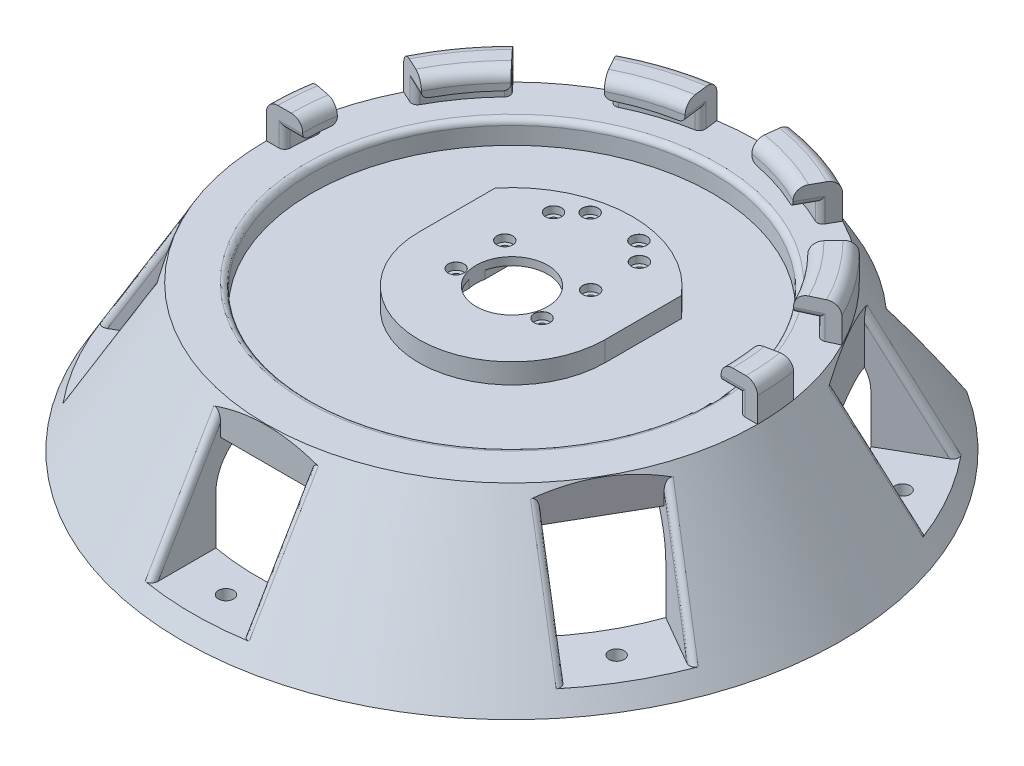
from build123d import *

# Parameters (mm, degrees)
SKETCH2_R                       = 12.5
CUT_EXTRUDE1_DEPTH              = 171.457229262
SKETCH3_R                       = 69.999999954
CUT_EXTRUDE2_DEPTH              = 8.000000002
CUT_EXTRUDE5_DEPTH              = 39
SKETCH8_W                       = 31.75
SKETCH8_H                       = 38.1
CUT_EXTRUDE6_DEPTH              = 44.45
CIRPATTERN2_COUNT               = 6
SKETCH9_R                       = 2.649982
CUT_EXTRUDE7_DEPTH              = 171.457229262
CIRPATTERN3_COUNT               = 6
REVOLVE2_ANGLE                  = 180
CUT_EXTRUDE9_DEPTH              = 12.7
SKETCH3_3_R                     = 12.5
CUT_EXTRUDE11_DEPTH             = 1
CBORE_FOR_M2_5_SHCS1_AT_2_COUNT = 2
CBORE_FOR_M2_5_SHCS1_AT_2_PITCH = 17
CBORE_FOR_M2_5_SHCS1_AT_3_COUNT = 2
CBORE_FOR_M2_5_SHCS1_AT_3_PITCH = 34
CBORE_FOR_M2_5_SHCS1_AT_4_COUNT = 2
CBORE_FOR_M2_5_SHCS1_AT_4_PITCH = 40.820828017
CBORE_FOR_M2_5_SHCS1_AT_5_COUNT = 2
CBORE_FOR_M2_5_SHCS1_AT_5_PITCH = 46.651259361
CBORE_FOR_M2_5_SHCS1_AT_6_COUNT = 2
CBORE_FOR_M2_5_SHCS1_AT_6_PITCH = 45.343136195
CBORE_FOR_M2_5_SHCS1_AT_7_COUNT = 2
CBORE_FOR_M2_5_SHCS1_AT_7_PITCH = 34.481879299
CBORE_FOR_M2_5_SHCS1_AT_8_COUNT = 2
CBORE_FOR_M2_5_SHCS1_AT_8_PITCH = 30
FILLET1_R                       = 4
FILLET2_R                       = 2
FILLET3_R                       = 2
FILLET4_R                       = 2
FILLET5_R                       = 2
FILLET6_R                       = 16
FILLET7_R                       = 16
FILLET8_R                       = 16
FILLET9_R                       = 1
CUT_EXTRUDE12_DEPTH             = 8.05
CUT_EXTRUDE15_START             = -5.3
SKETCH20_R                      = 1.45
CUT_EXTRUDE15_DEPTH             = 5.3


# Some blends are built 0.0001 mm under size
with BuildPart() as part:
    # Sketch1 → Revolve1 (revolve)
    with BuildSketch(Plane.XY, mode=Mode.PRIVATE) as revolve1_sk:
        Polygon((0, 0), (-85.725, 0), (-115.054393675, -50.8), (0, -50.8), align=None)
    revolve(revolve1_sk.sketch.rotate(Axis((0, 0, 0), (0, -1, 0)), 270), axis=Axis((0, 0, 0), (0, -1, 0)))

    # Sketch2 → Cut-Extrude1 (cut, through all)
    with BuildSketch(Plane(origin=(0, 0, 0), x_dir=(1, 0, 0), z_dir=(0, 1, 0))):
        with Locations(Location((0, 0, 0), (0, 0, 270))):
            Circle(SKETCH2_R)
    extrude(amount=-CUT_EXTRUDE1_DEPTH, mode=Mode.SUBTRACT)

    # Sketch3 → Cut-Extrude2 (cut)
    with BuildSketch(Plane(origin=(0, 0, 0), x_dir=(1, 0, 0), z_dir=(0, 1, 0))):
        with Locations(Location((0, 0, 0), (0, 0, 270))):
            Circle(SKETCH3_R)
        with BuildLine():
            ThreePointArc((32.5, 0), (0, -32.5), (-32.5, 0))
            Line((-32.5, 0), (-32.5, 26.603571189))
            ThreePointArc((-32.5, 26.603571189), (0, 42), (32.5, 26.603571189))
            Line((32.5, 26.603571189), (32.5, 0))
        make_face(mode=Mode.SUBTRACT)
    extrude(amount=-CUT_EXTRUDE2_DEPTH, mode=Mode.SUBTRACT)

    # Sketch7 → Cut-Extrude5 (cut)
    with BuildSketch(Plane.XZ.offset(50.8)):
        with BuildLine():
            Line((-60, -65.598856697), (-60, -161.1))
            Line((-60, -161.1), (60, -161.1))
            Line((60, -161.1), (60, -65.598856697))
            ThreePointArc((60, -65.598856697), (0, 88.9), (-60, -65.598856697))
        make_face()
    extrude(amount=-CUT_EXTRUDE5_DEPTH, mode=Mode.SUBTRACT)

    # Sketch8 → Cut-Extrude6 (cut)
    with BuildSketch(Plane(origin=(0, 0, 0), x_dir=(1, 0, 0), z_dir=(0, 1, 0))):
        with Locations((0, -104.875)):
            Rectangle(SKETCH8_W, SKETCH8_H)
    cut_extrude6 = extrude(amount=-CUT_EXTRUDE6_DEPTH, mode=Mode.SUBTRACT)

    # CirPattern2: Cut-Extrude6 ×6 about axis, 1 skipped
    cirpattern2_axis = Axis((0, 0, 0), (0, -1, 0))
    add([cut_extrude6.rotate(cirpattern2_axis, i * 360 / CIRPATTERN2_COUNT) for i in range(1, CIRPATTERN2_COUNT) if i not in (3,)], mode=Mode.SUBTRACT)

    # Sketch9 → Cut-Extrude7 (cut, through all)
    with BuildSketch(Plane(origin=(0, 0, 0), x_dir=(1, 0, 0), z_dir=(0, 1, 0))):
        with Locations(Location((0, -99.814393675, 0), (0, 0, 270))):
            Circle(SKETCH9_R)
    cut_extrude7 = extrude(amount=-CUT_EXTRUDE7_DEPTH, mode=Mode.SUBTRACT)

    # CirPattern3: Cut-Extrude7 ×6 about axis
    cirpattern3_axis = Axis((0, 0, 0), (0, 1, 0))
    for i in range(1, CIRPATTERN3_COUNT):
        add(cut_extrude7.rotate(cirpattern3_axis, i * 360 / CIRPATTERN3_COUNT), mode=Mode.SUBTRACT)

    # Sketch12 → Revolve2 (revolve)
    with BuildSketch(Plane.XY):
        Polygon((85.725, 0), (85.725, 12.7), (73.025, 12.7), (73.025, 6.35), (79.375, 6.35), (79.375, 0), align=None)
    revolve(axis=Axis((0, 0, 0), (0, 1, 0)), revolution_arc=REVOLVE2_ANGLE)

    # Sketch18 → Cut-Extrude9 (cut)
    with BuildSketch(Plane(origin=(0, 12.7, 0), x_dir=(1, 0, 0), z_dir=(0, 1, 0))):
        Polygon((46.643270314, 89.718478222), (70.913780145, 72.084920653), (36.670415564, 35.160782448), (22.108109665, 45.740916989), align=None)
        Polygon((-15, 100), (-9, 50), (9, 50), (15, 100), align=None)
        Polygon((90.470396714, 45.167547182), (99.740906545, 16.635851693), (50.333978764, 6.891341072), (44.771672865, 24.010358365), align=None)
        Polygon((99.740906545, -16.635851693), (90.470396714, -45.167547182), (44.771672865, -24.010358365), (50.333978764, -6.891341072), align=None)
        Polygon((70.913780145, -72.084920653), (46.643270314, -89.718478222), (22.108109665, -45.740916989), (36.670415564, -35.160782448), align=None)
        Polygon((15, -100), (-15, -100), (-9, -50), (9, -50), align=None)
        Polygon((-46.643270314, -89.718478222), (-70.913780145, -72.084920653), (-36.670415564, -35.160782448), (-22.108109665, -45.740916989), align=None)
        Polygon((-90.470396714, -45.167547182), (-99.740906545, -16.635851693), (-50.333978764, -6.891341072), (-44.771672865, -24.010358365), align=None)
        Polygon((-99.740906545, 16.635851693), (-90.470396714, 45.167547182), (-44.771672865, 24.010358365), (-50.333978764, 6.891341072), align=None)
        Polygon((-70.913780145, 72.084920653), (-46.643270314, 89.718478222), (-22.108109665, 45.740916989), (-36.670415564, 35.160782448), align=None)
    extrude(amount=-CUT_EXTRUDE9_DEPTH, mode=Mode.SUBTRACT)

    # Sketch3<3> → Cut-Extrude11 (cut)
    # profile 1 of 5: a face of its own
    with BuildSketch(Plane(origin=(0, 0, 0), x_dir=(1, 0, 0), z_dir=(0, 1, 0))):
        with BuildLine():
            ThreePointArc((-18.668154703, 26.603571189), (-28.835438507, 14.992247533), (-32.5, 0))
            ThreePointArc((-32.5, 0), (0, -32.5), (32.5, 0))
            ThreePointArc((32.5, 0), (28.835438507, 14.992247533), (18.668154703, 26.603571189))
            Line((18.668154703, 26.603571189), (-18.668154703, 26.603571189))
        make_face()
        with Locations(Location((0, 0, 0), (0, 0, 270))):
            Circle(SKETCH3_3_R, mode=Mode.SUBTRACT)
    # profile 2 of 5: a face of its own
    with BuildSketch(Plane(origin=(0, 0, 0), x_dir=(1, 0, 0), z_dir=(0, 1, 0))):
        with BuildLine():
            Line((-32.5, 26.603571189), (-32.5, 0))
            ThreePointArc((-32.5, 0), (-28.835438507, 14.992247533), (-18.668154703, 26.603571189))
            Line((-18.668154703, 26.603571189), (-32.5, 26.603571189))
        make_face()
    # profile 3 of 5: a face of its own
    with BuildSketch(Plane(origin=(0, 0, 0), x_dir=(1, 0, 0), z_dir=(0, 1, 0))):
        with BuildLine():
            ThreePointArc((18.668154703, 26.603571189), (0, 32.5), (-18.668154703, 26.603571189))
            Line((-18.668154703, 26.603571189), (18.668154703, 26.603571189))
        make_face()
    # profile 4 of 5: a face of its own
    with BuildSketch(Plane(origin=(0, 0, 0), x_dir=(1, 0, 0), z_dir=(0, 1, 0))):
        with BuildLine():
            ThreePointArc((32.5, 26.603571189), (0, 42), (-32.5, 26.603571189))
            Line((-32.5, 26.603571189), (-18.668154703, 26.603571189))
            ThreePointArc((-18.668154703, 26.603571189), (0, 32.5), (18.668154703, 26.603571189))
            Line((18.668154703, 26.603571189), (32.5, 26.603571189))
        make_face()
    # profile 5 of 5: a face of its own
    with BuildSketch(Plane(origin=(0, 0, 0), x_dir=(1, 0, 0), z_dir=(0, 1, 0))):
        with BuildLine():
            ThreePointArc((18.668154703, 26.603571189), (28.835438507, 14.992247533), (32.5, 0))
            Line((32.5, 0), (32.5, 26.603571189))
            Line((32.5, 26.603571189), (18.668154703, 26.603571189))
        make_face()
    extrude(amount=-CUT_EXTRUDE11_DEPTH, mode=Mode.SUBTRACT)

    # Sketch24 → CBORE for M2.5 SHCS1 (revolve, cut)
    with BuildSketch(Plane(origin=(-15, -1, 4.5), x_dir=(0, 0, 1), z_dir=(1, 0, 0))):
        Polygon((0, 0), (0, 49.8), (1.45, 49.8), (1.45, 2.5), (2.75, 2.5), (2.75, 0.025), (2.775, 0), align=None)
    cbore_for_m2_5_shcs1 = revolve(axis=Axis((-15, 5.35, 4.5), (0, -1, 0)), mode=Mode.SUBTRACT)

    # CBORE for M2.5 SHCS1 at 2: CBORE for M2.5 SHCS1 ×2
    with Locations(*[(0, 0, -i * CBORE_FOR_M2_5_SHCS1_AT_2_PITCH) for i in range(1, CBORE_FOR_M2_5_SHCS1_AT_2_COUNT)]):
        add(cbore_for_m2_5_shcs1, mode=Mode.SUBTRACT)

    # CBORE for M2.5 SHCS1 at 3: CBORE for M2.5 SHCS1 ×2
    with Locations(*[(0, 0, -i * CBORE_FOR_M2_5_SHCS1_AT_3_PITCH) for i in range(1, CBORE_FOR_M2_5_SHCS1_AT_3_COUNT)]):
        add(cbore_for_m2_5_shcs1, mode=Mode.SUBTRACT)

    # CBORE for M2.5 SHCS1 at 4: CBORE for M2.5 SHCS1 ×2
    with Locations(*[Vector(0.15923243882462063, 0, -0.9872411207126472) * (i * CBORE_FOR_M2_5_SHCS1_AT_4_PITCH) for i in range(1, CBORE_FOR_M2_5_SHCS1_AT_4_COUNT)]):
        add(cbore_for_m2_5_shcs1, mode=Mode.SUBTRACT)

    # CBORE for M2.5 SHCS1 at 5: CBORE for M2.5 SHCS1 ×2
    with Locations(*[Vector(0.5037377408822789, 0, -0.8638566364917376) * (i * CBORE_FOR_M2_5_SHCS1_AT_5_PITCH) for i in range(1, CBORE_FOR_M2_5_SHCS1_AT_5_COUNT)]):
        add(cbore_for_m2_5_shcs1, mode=Mode.SUBTRACT)

    # CBORE for M2.5 SHCS1 at 6: CBORE for M2.5 SHCS1 ×2
    with Locations(*[Vector(0.6616216370868465, 0, -0.7498378553650925) * (i * CBORE_FOR_M2_5_SHCS1_AT_6_PITCH) for i in range(1, CBORE_FOR_M2_5_SHCS1_AT_6_COUNT)]):
        add(cbore_for_m2_5_shcs1, mode=Mode.SUBTRACT)

    # CBORE for M2.5 SHCS1 at 7: CBORE for M2.5 SHCS1 ×2
    with Locations(*[Vector(0.8700221858486125, 0, -0.4930125719808802) * (i * CBORE_FOR_M2_5_SHCS1_AT_7_PITCH) for i in range(1, CBORE_FOR_M2_5_SHCS1_AT_7_COUNT)]):
        add(cbore_for_m2_5_shcs1, mode=Mode.SUBTRACT)

    # CBORE for M2.5 SHCS1 at 8: CBORE for M2.5 SHCS1 ×2
    with Locations(*[(i * CBORE_FOR_M2_5_SHCS1_AT_8_PITCH, 0, 0) for i in range(1, CBORE_FOR_M2_5_SHCS1_AT_8_COUNT)]):
        add(cbore_for_m2_5_shcs1, mode=Mode.SUBTRACT)

    # Fillet1
    fillet1_edges = [part.edges().sort_by_distance(p)[0] for p in [
        (-85.450905057, 12.7, -6.849704366),
        (-72.808821363, 12.7, -5.614815819),
        (-59.078466014, 12.7, -42.923018049),
        (-22.565966014, 12.7, -69.450902102),
        (22.565966014, 12.7, -69.450902102),
        (59.078466014, 12.7, -42.923018049),
        (72.808821363, 12.7, -5.614815819),
        (-69.352981843, 12.7, -50.387890753),
        (-26.490481843, 12.7, -81.529319859),
        (26.490481843, 12.7, -81.529319859),
        (69.352981843, 12.7, -50.387890753),
        (85.450905057, 12.7, -6.849704365),
    ]]
    fillet(fillet1_edges, radius=FILLET1_R)

    # Fillet2
    fillet2_edges = [part.edges().sort_by_distance(p)[0] for p in [
        (-76.2, 6.35, 0),
        (76.2, 6.35, 0),
        (67.844410645, 6.35, -34.692369341),
        (75.278944251, 6.35, -11.811227656),
        (34.49561812, 6.35, -67.9446604),
        (53.95947979, 6.35, -53.803337137),
        (-75.278944251, 6.35, -11.811227656),
        (-67.844410645, 6.35, -34.692369341),
        (-53.95947979, 6.35, -53.803337137),
        (-34.49561812, 6.35, -67.9446604),
        (12.029328065, 6.35, -75.24440054),
        (-12.029328065, 6.35, -75.24440054),
    ]]
    fillet(fillet2_edges, radius=FILLET2_R)

    # Fillet3
    fillet3_edges = [part.edges().sort_by_distance(p)[0] for p in [
        (-78.396323126, 4.175, -12.426067172),
        (-56.120098678, 4.175, -56.133102082),
        (-70.727816733, 4.175, -36.027303052),
        (-12.407903987, 4.175, -78.399199892),
        (56.120098678, 4.175, -56.133102082),
        (78.396323126, 4.175, -12.426067171),
        (-79.375, 4.175, 0),
        (-36.043688298, 4.175, -70.719468033),
        (12.407903987, 4.175, -78.399199892),
        (36.043688298, 4.175, -70.719468033),
        (70.727816733, 4.175, -36.027303052),
        (79.375, 4.175, 0),
    ]]
    fillet(fillet3_edges, radius=FILLET3_R)

    # Fillet4
    fillet4_edges = [part.edges().sort_by_distance(p)[0] for p in [
        (92.853698409, -23.56380487, 35.278236725),
        (76.978698409, -23.56380487, 62.774543295),
        (76.978698409, -23.56380487, -62.774543295),
        (92.853698409, -23.56380487, -35.278236725),
        (-92.853698409, -23.56380487, -35.278236725),
        (-76.978698409, -23.56380487, -62.774543295),
        (-76.978698409, -23.56380487, 62.774543295),
        (-92.853698409, -23.56380487, 35.278236725),
        (15.875, -23.56380487, 98.05278002),
        (-15.875, -23.56380487, 98.05278002),
    ]]
    fillet(fillet4_edges, radius=FILLET4_R)

    # Fillet5
    fillet5_edges = [part.edges().sort_by_distance(p)[0] for p in [
        (0, 0, -69.999999954),
    ]]
    fillet(fillet5_edges, radius=FILLET5_R)

    # Fillet6
    # the kernel refuses this fillet: 16 mm, written as the material it adds along each edge
    with BuildSketch(Plane(origin=(0, -11.8, 0), x_dir=(0.26715940650180947, 0, 0.9636523499258438), z_dir=(0.9636523499258438, 0, -0.26715940650180947))) as fillet6_piece_1_section:
        with BuildLine():
            CenterArc((88.9 - FILLET6_R, FILLET6_R), FILLET6_R, 270, 90)
            Line((88.9, FILLET6_R), (88.9, 0))
            Line((88.9, 0), (88.9 - FILLET6_R, 0))
        make_face()
    fillet6_piece_1 = revolve(axis=Axis((0, -11.8, 0), (0, -1, 0)), revolution_arc=90.990609321, mode=Mode.PRIVATE)
    fillet6_piece_1 = split(fillet6_piece_1, bisect_by=Plane(origin=(15.875, -14.981885519, 82.675852162), z_dir=(1, 0, 0)), keep=Keep.TOP, mode=Mode.PRIVATE)
    add(fillet6_piece_1)
    with BuildSketch(Plane(origin=(0, -11.8, 0), x_dir=(0.26715940650180947, 0, 0.9636523499258438), z_dir=(0.9636523499258438, 0, -0.26715940650180947))) as fillet6_piece_2_section:
        with BuildLine():
            CenterArc((88.9 - FILLET6_R, FILLET6_R), FILLET6_R, 270, 90)
            Line((88.9, FILLET6_R), (88.9, 0))
            Line((88.9, 0), (88.9 - FILLET6_R, 0))
        make_face()
    fillet6_piece_2 = revolve(axis=Axis((0, -11.8, 0), (0, -1, 0)), revolution_arc=90.990609321, mode=Mode.PRIVATE)
    fillet6_piece_2 = split(fillet6_piece_2, bisect_by=Plane(origin=(-54.96696383, -15.341247378, 50.066062411), z_dir=(0.5000000000000001, 0, 0.8660254037844386)), keep=Keep.TOP, mode=Mode.PRIVATE)
    fillet6_piece_2 = split(fillet6_piece_2, bisect_by=Plane(origin=(-15.875, -15.341247378, 72.635817925), z_dir=(-1, 0, 0)), keep=Keep.TOP, mode=Mode.PRIVATE)
    add(fillet6_piece_2)
    with BuildSketch(Plane(origin=(0, -11.8, 0), x_dir=(0.26715940650180947, 0, 0.9636523499258438), z_dir=(0.9636523499258438, 0, -0.26715940650180947))) as fillet6_piece_3_section:
        with BuildLine():
            CenterArc((88.9 - FILLET6_R, FILLET6_R), FILLET6_R, 270, 90)
            Line((88.9, FILLET6_R), (88.9, 0))
            Line((88.9, 0), (88.9 - FILLET6_R, 0))
        make_face()
    fillet6_piece_3 = revolve(axis=Axis((0, -11.8, 0), (0, -1, 0)), revolution_arc=90.990609321, mode=Mode.PRIVATE)
    fillet6_piece_3 = split(fillet6_piece_3, bisect_by=Plane(origin=(-79.536888464, -14.981885707, 27.589772918), z_dir=(-0.5000000000000001, 0, -0.8660254037844386)), keep=Keep.TOP, mode=Mode.PRIVATE)
    add(fillet6_piece_3)
    with BuildSketch(Plane(origin=(0, -11.8, 0), x_dir=(0.7009677122014474, 0, -0.7131930078534623), z_dir=(-0.7131930078534623, 0, -0.7009677122014474))) as fillet6_piece_4_section:
        with BuildLine():
            CenterArc((88.9 - FILLET6_R, FILLET6_R), FILLET6_R, 270, 90)
            Line((88.9, FILLET6_R), (88.9, 0))
            Line((88.9, 0), (88.9 - FILLET6_R, 0))
        make_face()
    fillet6_piece_4 = revolve(axis=Axis((0, -11.8, 0), (0, -1, 0)), revolution_arc=90.990609321, mode=Mode.PRIVATE)
    fillet6_piece_4 = split(fillet6_piece_4, bisect_by=Plane(origin=(70.84196383, -15.341247378, 22.56975584), z_dir=(0.5000000000000001, 0, -0.8660254037844386)), keep=Keep.TOP, mode=Mode.PRIVATE)
    fillet6_piece_4 = split(fillet6_piece_4, bisect_by=Plane(origin=(70.841963547, -15.341247378, -22.569755677), z_dir=(0.5000000000000004, 0, 0.8660254037844384)), keep=Keep.TOP, mode=Mode.PRIVATE)
    add(fillet6_piece_4)
    with BuildSketch(Plane(origin=(0, -11.8, 0), x_dir=(0.7009677122014474, 0, -0.7131930078534623), z_dir=(-0.7131930078534623, 0, -0.7009677122014474))) as fillet6_piece_5_section:
        with BuildLine():
            CenterArc((88.9 - FILLET6_R, FILLET6_R), FILLET6_R, 270, 90)
            Line((88.9, FILLET6_R), (88.9, 0))
            Line((88.9, 0), (88.9 - FILLET6_R, 0))
        make_face()
    fillet6_piece_5 = revolve(axis=Axis((0, -11.8, 0), (0, -1, 0)), revolution_arc=90.990609321, mode=Mode.PRIVATE)
    fillet6_piece_5 = split(fillet6_piece_5, bisect_by=Plane(origin=(63.661888464, -14.981885707, 55.086079488), z_dir=(-0.5000000000000001, 0, 0.8660254037844386)), keep=Keep.TOP, mode=Mode.PRIVATE)
    add(fillet6_piece_5)
    with BuildSketch(Plane(origin=(0, -11.8, 0), x_dir=(0.9681271187032567, 0, 0.2504593420723819), z_dir=(0.2504593420723819, 0, -0.9681271187032567))) as fillet6_piece_6_section:
        with BuildLine():
            CenterArc((88.9 - FILLET6_R, FILLET6_R), FILLET6_R, 270, 90)
            Line((88.9, FILLET6_R), (88.9, 0))
            Line((88.9, 0), (88.9 - FILLET6_R, 0))
        make_face()
    fillet6_piece_6 = revolve(axis=Axis((0, -11.8, 0), (0, -1, 0)), revolution_arc=90.990609321, mode=Mode.PRIVATE)
    fillet6_piece_6 = split(fillet6_piece_6, bisect_by=Plane(origin=(79.536888252, -14.981885519, 27.589772796), z_dir=(0.5000000000000001, 0, -0.8660254037844386)), keep=Keep.TOP, mode=Mode.PRIVATE)
    add(fillet6_piece_6)
    with BuildSketch(Plane(origin=(0, -11.8, 0), x_dir=(0.9681271187032567, 0, 0.2504593420723819), z_dir=(0.2504593420723819, 0, -0.9681271187032567))) as fillet6_piece_7_section:
        with BuildLine():
            CenterArc((88.9 - FILLET6_R, FILLET6_R), FILLET6_R, 270, 90)
            Line((88.9, FILLET6_R), (88.9, 0))
            Line((88.9, 0), (88.9 - FILLET6_R, 0))
        make_face()
    fillet6_piece_7 = revolve(axis=Axis((0, -11.8, 0), (0, -1, 0)), revolution_arc=90.990609321, mode=Mode.PRIVATE)
    fillet6_piece_7 = split(fillet6_piece_7, bisect_by=Plane(origin=(54.966963547, -15.341247378, 50.066062247), z_dir=(-0.5000000000000001, 0, 0.8660254037844386)), keep=Keep.TOP, mode=Mode.PRIVATE)
    fillet6_piece_7 = split(fillet6_piece_7, bisect_by=Plane(origin=(15.875, -15.341247378, 72.635818251), z_dir=(1, 0, 0)), keep=Keep.TOP, mode=Mode.PRIVATE)
    add(fillet6_piece_7)
    with BuildSketch(Plane(origin=(0, -11.8, 0), x_dir=(0.9681271187032567, 0, 0.2504593420723819), z_dir=(0.2504593420723819, 0, -0.9681271187032567))) as fillet6_piece_8_section:
        with BuildLine():
            CenterArc((88.9 - FILLET6_R, FILLET6_R), FILLET6_R, 270, 90)
            Line((88.9, FILLET6_R), (88.9, 0))
            Line((88.9, 0), (88.9 - FILLET6_R, 0))
        make_face()
    fillet6_piece_8 = revolve(axis=Axis((0, -11.8, 0), (0, -1, 0)), revolution_arc=90.990609321, mode=Mode.PRIVATE)
    fillet6_piece_8 = split(fillet6_piece_8, bisect_by=Plane(origin=(-15.875, -14.981885707, 82.675852407), z_dir=(-1, 0, 0)), keep=Keep.TOP, mode=Mode.PRIVATE)
    add(fillet6_piece_8)
    with BuildSketch(Plane(origin=(0, -11.8, 0), x_dir=(-0.7009677122014484, 0, 0.7131930078534614), z_dir=(0.7131930078534614, 0, 0.7009677122014484))) as fillet6_piece_9_section:
        with BuildLine():
            CenterArc((88.9 - FILLET6_R, FILLET6_R), FILLET6_R, 270, 90)
            Line((88.9, FILLET6_R), (88.9, 0))
            Line((88.9, 0), (88.9 - FILLET6_R, 0))
        make_face()
    fillet6_piece_9 = revolve(axis=Axis((0, -11.8, 0), (0, -1, 0)), revolution_arc=90.990609321, mode=Mode.PRIVATE)
    fillet6_piece_9 = split(fillet6_piece_9, bisect_by=Plane(origin=(-63.661888252, -14.981885519, 55.086079366), z_dir=(0.5000000000000001, 0, 0.8660254037844386)), keep=Keep.TOP, mode=Mode.PRIVATE)
    add(fillet6_piece_9)
    with BuildSketch(Plane(origin=(0, -11.8, 0), x_dir=(-0.7009677122014484, 0, 0.7131930078534614), z_dir=(0.7131930078534614, 0, 0.7009677122014484))) as fillet6_piece_10_section:
        with BuildLine():
            CenterArc((88.9 - FILLET6_R, FILLET6_R), FILLET6_R, 270, 90)
            Line((88.9, FILLET6_R), (88.9, 0))
            Line((88.9, 0), (88.9 - FILLET6_R, 0))
        make_face()
    fillet6_piece_10 = revolve(axis=Axis((0, -11.8, 0), (0, -1, 0)), revolution_arc=90.990609321, mode=Mode.PRIVATE)
    fillet6_piece_10 = split(fillet6_piece_10, bisect_by=Plane(origin=(-70.84196383, -15.341247378, -22.56975584), z_dir=(-0.49999999999999983, 0, 0.8660254037844388)), keep=Keep.TOP, mode=Mode.PRIVATE)
    fillet6_piece_10 = split(fillet6_piece_10, bisect_by=Plane(origin=(-70.841963547, -15.341247378, 22.569755677), z_dir=(-0.5000000000000001, 0, -0.8660254037844386)), keep=Keep.TOP, mode=Mode.PRIVATE)
    add(fillet6_piece_10)

    # Fillet7
    fillet7_edges = [part.edges().sort_by_distance(p)[0] for p in [
        (64.036031191, -11.8, -61.665198526),
    ]]
    fillet(fillet7_edges, radius=FILLET7_R - 0.0001)  # a hair under: the kernel refuses the full size

    # Fillet8
    # the kernel refuses this fillet: 16 mm, written as the material it adds along each edge
    with BuildSketch(Plane(origin=(0, -11.8, 0), x_dir=(-0.9681187273777495, 0, -0.25049177571426695), z_dir=(-0.25049177571426695, 0, 0.9681187273777495))) as fillet8_piece_1_section:
        with BuildLine():
            CenterArc((88.9 - FILLET8_R, FILLET8_R), FILLET8_R, 270, 90)
            Line((88.9 - FILLET8_R, 0), (88.9, 0))
            Line((88.9, 0), (88.9, FILLET8_R))
        make_face()
    fillet8_piece_1 = revolve(axis=Axis((0, -11.8, 0), (0, -1, 0)), revolution_arc=58.825731772, mode=Mode.PRIVATE)
    fillet8_piece_1 = split(fillet8_piece_1, bisect_by=Plane(origin=(-74.398229209, -13.906298809, -42.788487017), z_dir=(0.8660254037844388, 0, 0.49999999999999983)), keep=Keep.TOP, mode=Mode.PRIVATE)
    fillet8_piece_1 = split(fillet8_piece_1, bisect_by=Plane(origin=(-60, -13.906298809, -41.216396761), z_dir=(-1, 0, 0)), keep=Keep.TOP, mode=Mode.PRIVATE)
    add(fillet8_piece_1)
    with BuildSketch(Plane(origin=(0, -11.8, 0), x_dir=(-0.9681187273777495, 0, -0.25049177571426695), z_dir=(-0.25049177571426695, 0, 0.9681187273777495))) as fillet8_piece_2_section:
        with BuildLine():
            CenterArc((88.9 - FILLET8_R, FILLET8_R), FILLET8_R, 270, 90)
            Line((88.9 - FILLET8_R, 0), (88.9, 0))
            Line((88.9, 0), (88.9, FILLET8_R))
        make_face()
    fillet8_piece_2 = revolve(axis=Axis((0, -11.8, 0), (0, -1, 0)), revolution_arc=58.825731772, mode=Mode.PRIVATE)
    fillet8_piece_2 = split(fillet8_piece_2, bisect_by=Plane(origin=(-66.903440173, -17.970411927, -56.957590241), z_dir=(0.4999999999999998, 0, -0.8660254037844388)), keep=Keep.TOP, mode=Mode.PRIVATE)
    fillet8_piece_2 = split(fillet8_piece_2, bisect_by=Plane(origin=(-60, -17.970411927, -59.221513101), z_dir=(-1, 0, 0)), keep=Keep.TOP, mode=Mode.PRIVATE)
    add(fillet8_piece_2)

    # Fillet9
    fillet9_edges = [part.edges().sort_by_distance(p)[0] for p in [
        (-60, -31.116866881, -84.56763471),
        (60, -31.116866881, -84.56763471),
    ]]
    fillet(fillet9_edges, radius=FILLET9_R)

    # Sketch28 → Cut-Extrude12 (cut)
    with BuildSketch(Plane.XZ.offset(11.8)):
        with BuildLine():
            Line((9.2, 12), (-9.2, 12))
            ThreePointArc((-9.2, 12), (-11.321320344, 11.121320344), (-12.2, 9))
            Line((-12.2, 9), (-12.2, -30))
            ThreePointArc((-12.2, -30), (-11.321320344, -32.121320344), (-9.2, -33))
            Line((-9.2, -33), (9.2, -33))
            ThreePointArc((9.2, -33), (11.321320344, -32.121320344), (12.2, -30))
            Line((12.2, -30), (12.2, 9))
            ThreePointArc((12.2, 9), (11.321320344, 11.121320344), (9.2, 12))
        make_face()
    extrude(amount=-CUT_EXTRUDE12_DEPTH, mode=Mode.SUBTRACT)

    # Sketch20 → Cut-Extrude15 (cut)
    with BuildSketch(Plane.XZ.offset(11.8).offset(CUT_EXTRUDE15_START)):
        Polygon((-22.5, 20), (-22.5, -33), (-12.5, -40), (12.5, -40), (22.5, -33), (22.5, 20), align=None)
        with Locations(Location((-15, -29.5, 0), (0, 0, 90))):
            Circle(SKETCH20_R, mode=Mode.SUBTRACT)
        with Locations(Location((-8.5, -35.8, 0), (0, 0, 90))):
            Circle(SKETCH20_R, mode=Mode.SUBTRACT)
        with Locations(Location((-15, -12.5, 0), (0, 0, 90))):
            Circle(SKETCH20_R, mode=Mode.SUBTRACT)
        with BuildLine():
            Line((-9.2, 12), (-3.5, 12))
            ThreePointArc((-3.5, 12), (-1.767766953, 12.374368671), (0, 12.5))
            ThreePointArc((0, 12.5), (1.767766953, 12.374368671), (3.5, 12))
            Line((3.5, 12), (9.2, 12))
            ThreePointArc((9.2, 12), (11.321320344, 11.121320344), (12.2, 9))
            Line((12.2, 9), (12.2, 2.722131518))
            ThreePointArc((12.2, 2.722131518), (12.5, 0), (12.2, -2.722131518))
            Line((12.2, -2.722131518), (12.2, -30))
            ThreePointArc((12.2, -30), (11.321320344, -32.121320344), (9.2, -33))
            Line((9.2, -33), (-9.2, -33))
            ThreePointArc((-9.2, -33), (-11.321320344, -32.121320344), (-12.2, -30))
            Line((-12.2, -30), (-12.2, -2.722131518))
            ThreePointArc((-12.2, -2.722131518), (-12.5, 0), (-12.2, 2.722131518))
            Line((-12.2, 2.722131518), (-12.2, 9))
            ThreePointArc((-12.2, 9), (-11.321320344, 11.121320344), (-9.2, 12))
        make_face(mode=Mode.SUBTRACT)
        with Locations(Location((8.5, -35.8, 0), (0, 0, 90))):
            Circle(SKETCH20_R, mode=Mode.SUBTRACT)
        with Locations(Location((15, -29.5, 0), (0, 0, 90))):
            Circle(SKETCH20_R, mode=Mode.SUBTRACT)
        with Locations(Location((15, -12.5, 0), (0, 0, 90))):
            Circle(SKETCH20_R, mode=Mode.SUBTRACT)
        with Locations(Location((-15, 4.5, 0), (0, 0, 90))):
            Circle(SKETCH20_R, mode=Mode.SUBTRACT)
        with Locations(Location((15, 4.5, 0), (0, 0, 90))):
            Circle(SKETCH20_R, mode=Mode.SUBTRACT)
    extrude(amount=CUT_EXTRUDE15_DEPTH, mode=Mode.SUBTRACT)


solid = part.part
